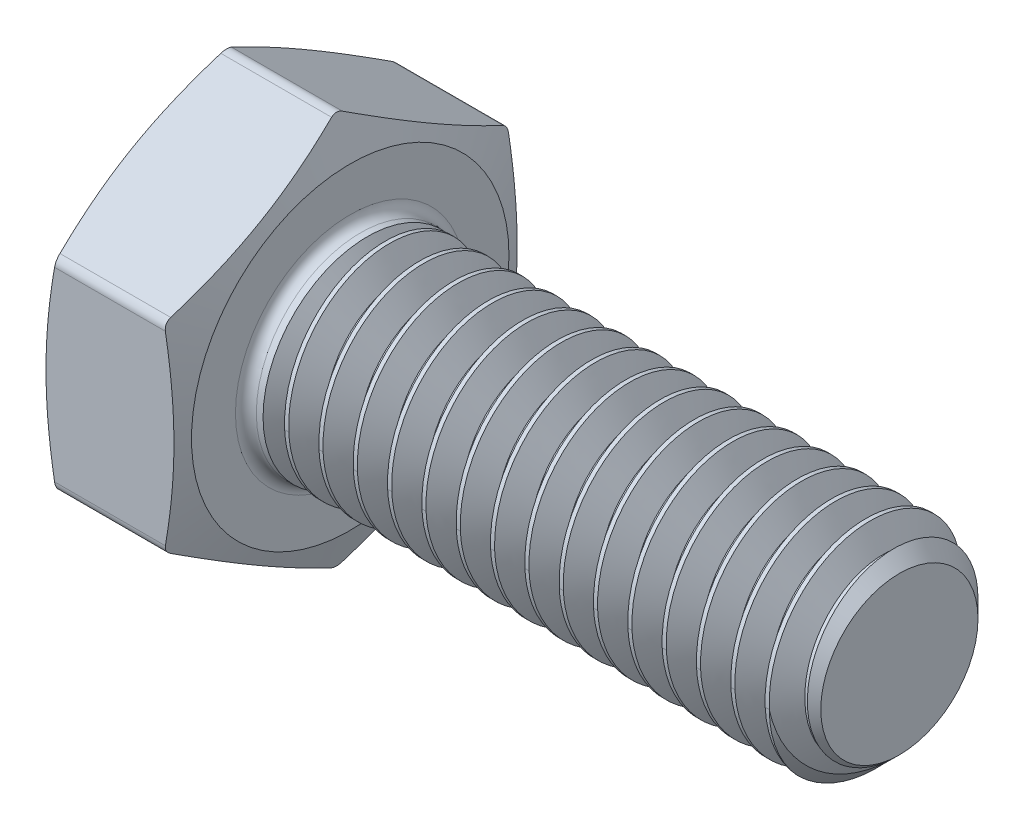
from build123d import *

# Parameters (mm, degrees)
SKETCH2_R           = 2.413
BOSS_EXTRUDE1_DEPTH = 12.7
BOSS_EXTRUDE2_DEPTH = 3.175
SKETCH5_OUTSIDE_W   = 31.38
SKETCH5_OUTSIDE_H   = 32.608
SKETCH5_OUTSIDE_R   = 3.67109375
CUT_EXTRUDE1_DEPTH  = 3.175
CUT_EXTRUDE1_DRAFT  = -70
SKETCH15_OUTSIDE_W  = 96.758
SKETCH15_OUTSIDE_H  = 97.986
SKETCH15_OUTSIDE_R  = 3.67109375
CUT_EXTRUDE2_DEPTH  = 15.072749506
CUT_EXTRUDE2_DRAFT  = -70
FILLET7_R           = 0.248046875
CHAMFER1_SIZE       = 0.5953125
FILLET4_R           = 0.2413
CUT_SWEEP1_PITCH    = 0.79375
CUT_SWEEP1_TO       = 12.303125


with BuildPart() as part:
    # Sketch2 → Boss-Extrude1 (new body)
    with BuildSketch(Plane(origin=(0, 0, 0), x_dir=(0, 0, -1), z_dir=(1, 0, 0))):
        Circle(SKETCH2_R)
    extrude(amount=BOSS_EXTRUDE1_DEPTH)

    # Sketch3 → Boss-Extrude2 (add)
    with BuildSketch(Plane.ZY):
        Polygon((0, 4.582717762), (-3.96875, 2.291358881), (-3.96875, -2.291358881), (0, -4.582717762), (3.96875, -2.291358881), (3.96875, 2.291358881), align=None)
    extrude(amount=BOSS_EXTRUDE2_DEPTH)


with BuildPart() as cut_extrude1_tool:
    # Sketch5 outside → Cut-Extrude1 (with draft: the straight prism first)
    with BuildSketch(Plane.ZY.offset(3.175)):
        Rectangle(SKETCH5_OUTSIDE_W, SKETCH5_OUTSIDE_H)
        Circle(SKETCH5_OUTSIDE_R, mode=Mode.SUBTRACT)
    extrude(amount=-CUT_EXTRUDE1_DEPTH)
    # Cut-Extrude1: the draft: its side faces are tilted about the plane it starts from
    cut_extrude1_sides = [cut_extrude1_tool.faces().sort_by_distance(p)[0] for p in [
        (-1.5875, -16.304, 0),
        (-1.5875, 0, 15.69),
        (-1.5875, 16.304, 0),
        (-1.5875, 0, -15.69),
        (-1.5875, 0, -3.67109375),
    ]]
    draft(cut_extrude1_sides, Plane.ZY.offset(3.175), CUT_EXTRUDE1_DRAFT)


with BuildPart() as part_1:
    add(part.part)

    # Cut-Extrude1: cut by cut_extrude1_tool
    add(cut_extrude1_tool.part, mode=Mode.SUBTRACT)


with BuildPart() as cut_extrude2_tool:
    # Sketch15 outside → Cut-Extrude2 (with draft: the straight prism first)
    with BuildSketch(Plane(origin=(0, 0, 0), x_dir=(0, 0, -1), z_dir=(1, 0, 0))):
        Rectangle(SKETCH15_OUTSIDE_W, SKETCH15_OUTSIDE_H)
        Circle(SKETCH15_OUTSIDE_R, mode=Mode.SUBTRACT)
    extrude(amount=-CUT_EXTRUDE2_DEPTH)
    # Cut-Extrude2: the draft: its side faces are tilted about the plane it starts from
    cut_extrude2_sides = [cut_extrude2_tool.faces().sort_by_distance(p)[0] for p in [
        (-7.536374753, -48.993, 0),
        (-7.536374753, 0, -48.379),
        (-7.536374753, 48.993, 0),
        (-7.536374753, 0, 48.379),
        (-7.536374753, 0, 3.67109375),
    ]]
    draft(cut_extrude2_sides, Plane(origin=(0, 0, 0), x_dir=(0, 0, -1), z_dir=(1, 0, 0)), CUT_EXTRUDE2_DRAFT)


with BuildPart() as part_2:
    add(part_1.part)

    # Cut-Extrude2: cut by cut_extrude2_tool
    add(cut_extrude2_tool.part, mode=Mode.SUBTRACT)

    # Fillet7
    fillet7_edges = [part_2.edges().sort_by_distance(p)[0] for p in [
        (-1.5875, -4.582717762, 0),
        (-1.5875, -2.291358881, -3.96875),
        (-1.5875, 2.291358881, -3.96875),
        (-1.5875, 4.582717762, 0),
        (-1.5875, -2.291358881, 3.96875),
        (-1.5875, 2.291358881, 3.96875),
    ]]
    fillet(fillet7_edges, radius=FILLET7_R)

    # Chamfer1
    chamfer1_edges = [part_2.edges().sort_by_distance(p)[0] for p in [
        (12.7, 0, 2.413),
    ]]
    chamfer(chamfer1_edges, length=CHAMFER1_SIZE)

    # Fillet4
    fillet4_edges = [part_2.edges().sort_by_distance(p)[0] for p in [
        (0, 0, 2.413),
    ]]
    fillet(fillet4_edges, radius=FILLET4_R)


with BuildPart() as body_2:
    # Split1: the piece on the far side of the plane
    add(part_2.part)
    split(bisect_by=Plane(origin=(0.396875, 0, 0), x_dir=(0, 0, 1), z_dir=(1, 0, 0)), keep=Keep.BOTTOM)


with BuildPart() as part_3:
    add(part_2.part)

    # Split1
    split(bisect_by=Plane(origin=(0.396875, 0, 0), x_dir=(0, 0, 1), z_dir=(1, 0, 0)), keep=Keep.TOP)

    # Cut-Sweep1: arcs per turn and ends read off the stored shape
    # Cut-Sweep1: the profile of Sketch13 profile screwed along a right-hand helix through 17 turns, 8 arcs to a turn; built about Z, then put on its axis
    cut_sweep1_z = Axis((0, 0, 0), (0, 0, 1))
    cut_sweep1_corners = [(2.4133, 0, 0.000173205), (2.4133, 0, -0.698673205), (1.890570175, 0, -0.396875), (1.890570175, 0, -0.301625)]
    with BuildLine(mode=Mode.PRIVATE) as cut_sweep1_profile:
        Line(cut_sweep1_corners[0], cut_sweep1_corners[1])
        Line(cut_sweep1_corners[1], cut_sweep1_corners[2])
        Line(cut_sweep1_corners[2], cut_sweep1_corners[3])
        Line(cut_sweep1_corners[3], cut_sweep1_corners[0])
    cut_sweep1_cap = Face(cut_sweep1_profile.wire())
    cut_sweep1_turn_angles = [0, 22.5, 45, 67.5, 90, 112.5, 135, 157.5, 180, 202.5, 225, 247.5, 270, 292.5, 315, 337.5, 360]
    cut_sweep1_turn_weights = [1, 0.9238795325112867, 1, 0.9238795325112867, 1, 0.9238795325112867, 1, 0.9238795325112867, 1, 0.9238795325112867, 1, 0.9238795325112867, 1, 0.9238795325112867, 1, 0.9238795325112867, 1]
    cut_sweep1_turn_rails = [Edge.make_bspline([Vector(p[0], p[1], 0).rotate(cut_sweep1_z, cut_sweep1_turn_angles[k]) / cut_sweep1_turn_weights[k] + Vector(0, 0, p[2] + CUT_SWEEP1_PITCH * cut_sweep1_turn_angles[k] / 360) for k in range(17)], [0, 0, 0, 1, 1, 2, 2, 3, 3, 4, 4, 5, 5, 6, 6, 7, 7, 8, 8, 8], 2, cut_sweep1_turn_weights) for p in cut_sweep1_corners]
    cut_sweep1_turn_sides = [Face.make_surface_from_curves(cut_sweep1_turn_rails[p[0]], cut_sweep1_turn_rails[p[1]]) for p in [(0, 1), (1, 2), (2, 3), (3, 0)]]
    cut_sweep1 = Plane(origin=(12.7, 0, 0), x_dir=(0, 1, 0), z_dir=(-1, 0, 0)) * split(Solid(Shell([*[p.moved(Location((0, 0, CUT_SWEEP1_PITCH * i))) for i in range(17) for p in cut_sweep1_turn_sides], cut_sweep1_cap, cut_sweep1_cap.rotate(cut_sweep1_z, 6120).moved(Location((0, 0, CUT_SWEEP1_PITCH * 6120 / 360)))])), bisect_by=Plane.XY.offset(CUT_SWEEP1_TO), keep=Keep.BOTTOM, mode=Mode.PRIVATE)
    add(cut_sweep1, mode=Mode.SUBTRACT)

    add(body_2.part)  # Boss-Extrude4 merges body 2
    # Boss-Extrude4: read off the stored shape, not the designer's step
    # Boss-Extrude4 outline → Boss-Extrude4 (revolve)
    with BuildSketch(Plane.YX):
        Polygon((2.413, 0.396875), (1.890562449, 0.71078715), (1.890562449, 0.396875), align=None)
    revolve(axis=Axis((0, 0, 0), (1, 0, 0)))


solid = part_3.part
